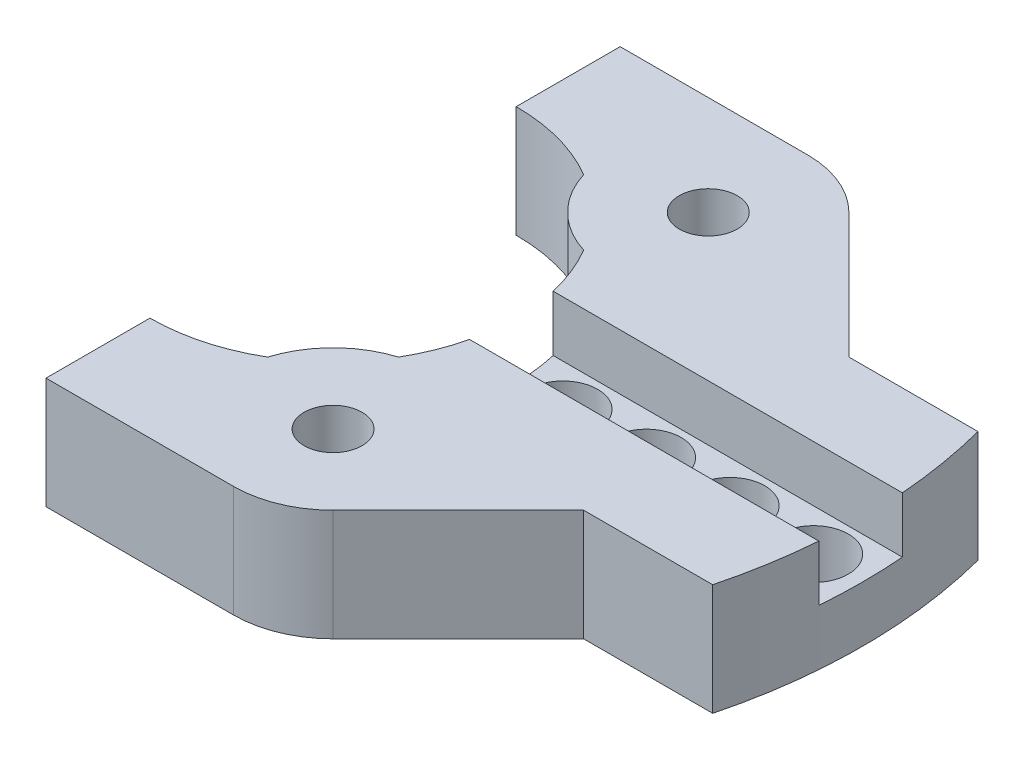
from build123d import *
from build123d.topology import SkipClean

# Parameters (mm, degrees)
SKETCH1_R           = 2.0828
SKETCH1_R_2         = 2.5
BOSS_EXTRUDE2_DEPTH = 4
BOSS_EXTRUDE3_START = 4
SKETCH5_R           = 3.429
SKETCH5_R_2         = 2.5
BOSS_EXTRUDE3_DEPTH = 4
CUT_EXTRUDE2_START  = -4
CUT_EXTRUDE2_DEPTH  = 4


with BuildPart() as part:
    # Sketch1 → Boss-Extrude2 (new body)
    with BuildSketch(Plane(origin=(0, 0, 0), x_dir=(1, 0, 0), z_dir=(0, 1, 0))):
        with BuildLine():
            Line((0, 20.614134159), (0, 13.151202806))
            ThreePointArc((0, 13.151202806), (3.445207277, 12.691914043), (6.64977573, 11.346127885))
            ThreePointArc((6.64977573, 11.346127885), (8.418990091, 8.418990091), (11.346127885, 6.64977573))
            ThreePointArc((11.346127885, 6.64977573), (13.151202806, 0), (11.346127885, -6.64977573))
            ThreePointArc((11.346127885, -6.64977573), (8.418990091, -8.418990091), (6.64977573, -11.346127885))
            ThreePointArc((6.64977573, -11.346127885), (3.445207277, -12.691914043), (0, -13.151202806))
            Line((0, -13.151202806), (0, -20.614134159))
            Line((0, -20.614134159), (13.470384159, -20.614134159))
            ThreePointArc((13.470384159, -20.614134159), (16.204178929, -20.070348569), (18.521778227, -18.521778227))
            Line((18.521778227, -18.521778227), (27.518556454, -9.525))
            Line((27.518556454, -9.525), (36.786877756, -9.525))
            ThreePointArc((36.786877756, -9.525), (38, 0), (36.786877756, 9.525))
            Line((36.786877756, 9.525), (27.518556454, 9.525))
            Line((27.518556454, 9.525), (18.521778227, 18.521778227))
            ThreePointArc((18.521778227, 18.521778227), (16.204178929, 20.070348569), (13.470384159, 20.614134159))
            Line((13.470384159, 20.614134159), (0, 20.614134159))
        make_face()
        with Locations((13.470384159, 13.470384159)):
            Circle(SKETCH1_R, mode=Mode.SUBTRACT)
        with Locations((13.470384159, -13.470384159)):
            Circle(SKETCH1_R, mode=Mode.SUBTRACT)
        with Locations((16.5, 0)):
            Circle(SKETCH1_R_2, mode=Mode.SUBTRACT)
        with Locations((22.5, 0)):
            Circle(SKETCH1_R_2, mode=Mode.SUBTRACT)
        with Locations((28.5, 0)):
            Circle(SKETCH1_R_2, mode=Mode.SUBTRACT)
        with Locations((34.5, 0)):
            Circle(SKETCH1_R_2, mode=Mode.SUBTRACT)
    extrude(amount=BOSS_EXTRUDE2_DEPTH)

    # Sketch5 → Boss-Extrude3 (add)
    with SkipClean():  # the faces are left unmerged after this step: merging them gives an invalid solid
        with BuildSketch(Plane.XZ.offset(BOSS_EXTRUDE3_START)):
            with BuildLine():
                ThreePointArc((36.786877756, -9.525), (38, 0), (36.786877756, 9.525))
                Line((36.786877756, 9.525), (27.518556454, 9.525))
                Line((27.518556454, 9.525), (18.521778227, 18.521778227))
                ThreePointArc((18.521778227, 18.521778227), (16.204178929, 20.070348569), (13.470384159, 20.614134159))
                Line((13.470384159, 20.614134159), (0, 20.614134159))
                Line((0, 20.614134159), (0, 13.151202806))
                ThreePointArc((0, 13.151202806), (3.445207277, 12.691914043), (6.64977573, 11.346127885))
                ThreePointArc((6.64977573, 11.346127885), (9.299304685, 9.299304685), (11.346127885, 6.64977573))
                ThreePointArc((11.346127885, 6.64977573), (13.151202806, 0), (11.346127885, -6.64977573))
                ThreePointArc((11.346127885, -6.64977573), (9.299304685, -9.299304685), (6.64977573, -11.346127885))
                ThreePointArc((6.64977573, -11.346127885), (3.445207277, -12.691914043), (0, -13.151202806))
                Line((0, -13.151202806), (0, -20.614134159))
                Line((0, -20.614134159), (13.470384159, -20.614134159))
                ThreePointArc((13.470384159, -20.614134159), (16.204178929, -20.070348569), (18.521778227, -18.521778227))
                Line((18.521778227, -18.521778227), (27.518556454, -9.525))
                Line((27.518556454, -9.525), (36.786877756, -9.525))
            make_face()
            with Locations((13.470384159, -13.470384159)):
                Circle(SKETCH5_R, mode=Mode.SUBTRACT)
            with Locations((16.5, 0)):
                Circle(SKETCH5_R_2, mode=Mode.SUBTRACT)
            with Locations((13.470384159, 13.470384159)):
                Circle(SKETCH5_R, mode=Mode.SUBTRACT)
            with BuildLine():
                ThreePointArc((25, 0), (22.5, -2.5), (20, 0))
                ThreePointArc((20, 0), (22.5, 2.5), (25, 0))
            make_face(mode=Mode.SUBTRACT)
            with BuildLine():
                ThreePointArc((31, 0), (28.5, -2.5), (26, 0))
                ThreePointArc((26, 0), (28.5, 2.5), (31, 0))
            make_face(mode=Mode.SUBTRACT)
            with BuildLine():
                ThreePointArc((37, 0), (34.5, -2.5), (32, 0))
                ThreePointArc((32, 0), (34.5, 2.5), (37, 0))
            make_face(mode=Mode.SUBTRACT)
        extrude(amount=-BOSS_EXTRUDE3_DEPTH)

    # Sketch6 → Cut-Extrude2 (cut)
    with SkipClean():  # the faces are left unmerged after this step: merging them gives an invalid solid
        with BuildSketch(Plane(origin=(0, 4, 0), x_dir=(1, 0, 0), z_dir=(0, 1, 0)).offset(CUT_EXTRUDE2_START)):
            with BuildLine():
                Line((12.804457632, -3), (37.88139385, -3))
                ThreePointArc((37.88139385, -3), (38, 0), (37.88139385, 3))
                Line((37.88139385, 3), (12.804457632, 3))
                ThreePointArc((12.804457632, 3), (13.151202806, 0), (12.804457632, -3))
            make_face()
        extrude(amount=CUT_EXTRUDE2_DEPTH, mode=Mode.SUBTRACT)


solid = part.part
